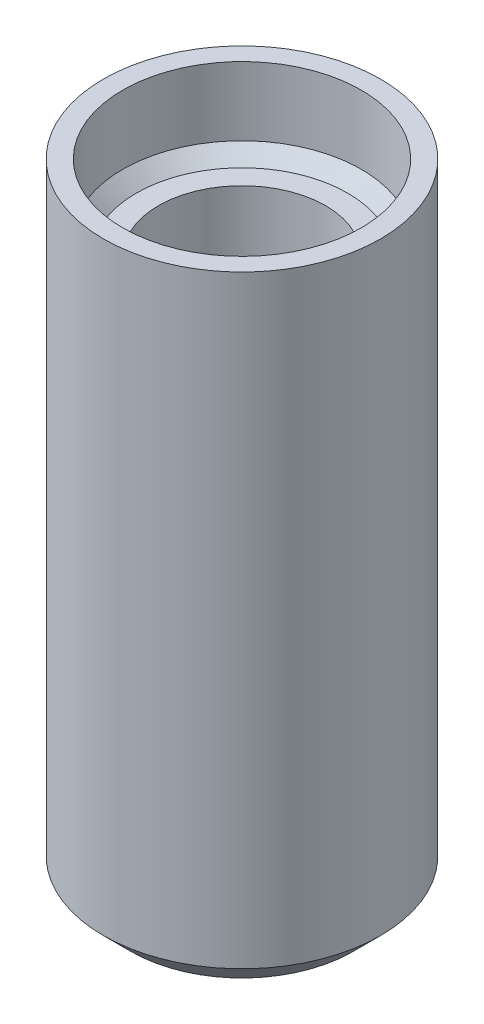
from build123d import *

# Parameters (mm, degrees)
SKETCH1_R           = 5.05
BOSS_EXTRUDE1_DEPTH = 20
SKETCH2_R           = 5.05
BOSS_EXTRUDE2_DEPTH = 2
SKETCH4_R           = 5.05
SKETCH4_R_2         = 4.35
BOSS_EXTRUDE3_DEPTH = 3
CHAMFER1_SIZE       = 1
CHAMFER2_SIZE       = 0.5


with BuildPart() as part:
    # Sketch1 → Boss-Extrude1 (new body)
    with BuildSketch(Plane(origin=(0, 0, 0), x_dir=(1, 0, 0), z_dir=(0, 1, 0))):
        Circle(SKETCH1_R)
        with BuildLine():
            Line((2.565151068, -1.65), (-2.565151068, -1.65))
            ThreePointArc((-2.565151068, -1.65), (0, 3.05), (2.565151068, -1.65))
        make_face(mode=Mode.SUBTRACT)
    extrude(amount=BOSS_EXTRUDE1_DEPTH)

    # Sketch2 → Boss-Extrude2 (add)
    with BuildSketch(Plane.XZ):
        Circle(SKETCH2_R)
    extrude(amount=-BOSS_EXTRUDE2_DEPTH)

    # Sketch4 → Boss-Extrude3 (add)
    with BuildSketch(Plane(origin=(0, 20, 0), x_dir=(1, 0, 0), z_dir=(0, 1, 0))):
        Circle(SKETCH4_R)
        Circle(SKETCH4_R_2, mode=Mode.SUBTRACT)
    extrude(amount=BOSS_EXTRUDE3_DEPTH)

    # Chamfer1
    chamfer1_edges = [part.edges().sort_by_distance(p)[0] for p in [
        (-5.05, 0, 0),
    ]]
    chamfer(chamfer1_edges, length=CHAMFER1_SIZE)

    # Chamfer2
    chamfer2_edges = [part.edges().sort_by_distance(p)[0] for p in [
        (-4.35, 20, 0),
    ]]
    chamfer(chamfer2_edges, length=CHAMFER2_SIZE)


solid = part.part
